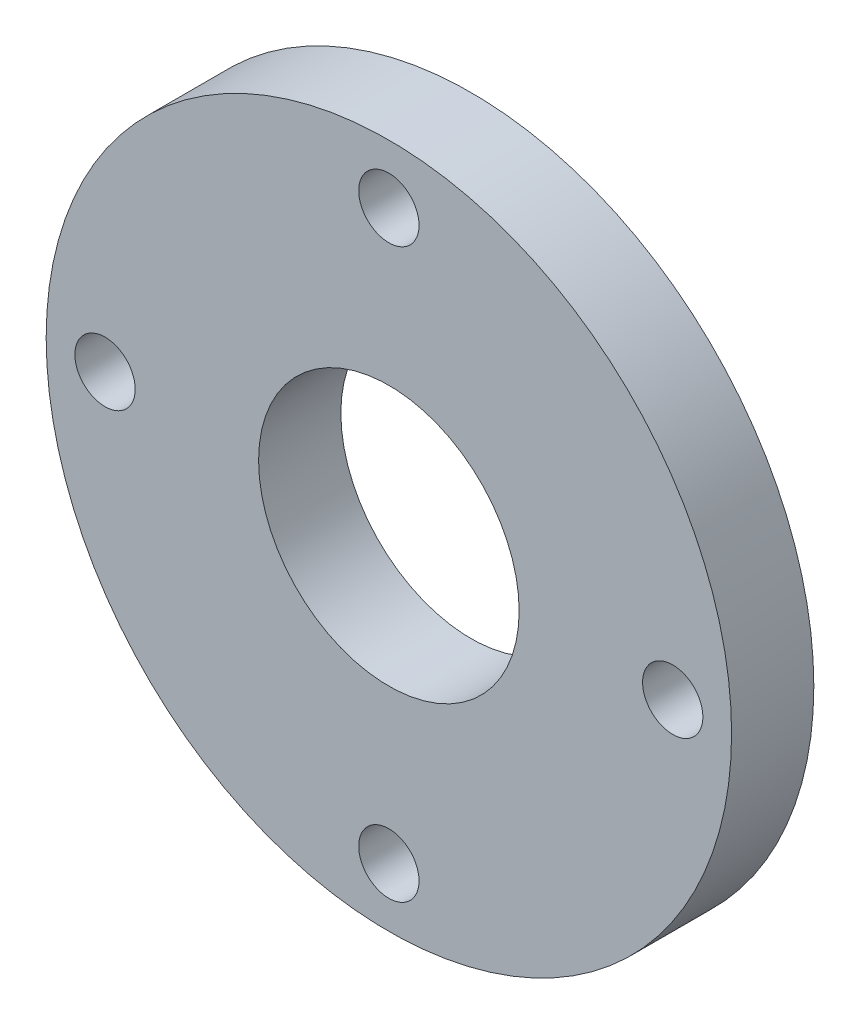
from build123d import *

# Parameters (mm, degrees)
SKETCH1_W            = 9
SKETCH1_H            = 28
SKETCH5_R            = 14.25575
SEAL_SEAT_DEPTH      = 54.791263231
M6_CLEARANCE_HOLE1_D = 6.6
CIRPATTERN1_COUNT    = 4


with BuildPart() as part:
    # Sketch1 → Main_body (revolve)
    with BuildSketch(Plane(origin=(0, 0, 0), x_dir=(0, 0, -1), z_dir=(1, 0, 0))):
        with Locations((-140.784, 23.5)):
            Rectangle(SKETCH1_W, SKETCH1_H)
    revolve(axis=Axis((0, 0, 1000), (0, 0, -1)))

    # Sketch5 → seal_seat (cut, through all)
    with BuildSketch(Plane.XY.offset(145.284)):
        Circle(SKETCH5_R)
    extrude(amount=-SEAL_SEAT_DEPTH, mode=Mode.SUBTRACT)

    # M6 Clearance Hole1 (through all)
    with Locations(Plane.XY.offset(145.284)):
        with Locations((0, 31.05935)):
            m6_clearance_hole1 = Hole(M6_CLEARANCE_HOLE1_D / 2)

    # CirPattern1: M6 Clearance Hole1 ×4 about axis
    cirpattern1_axis = Axis((0, 0, 1000), (0, 0, -1))
    for i in range(1, CIRPATTERN1_COUNT):
        add(m6_clearance_hole1.rotate(cirpattern1_axis, i * 360 / CIRPATTERN1_COUNT), mode=Mode.SUBTRACT)


solid = part.part
